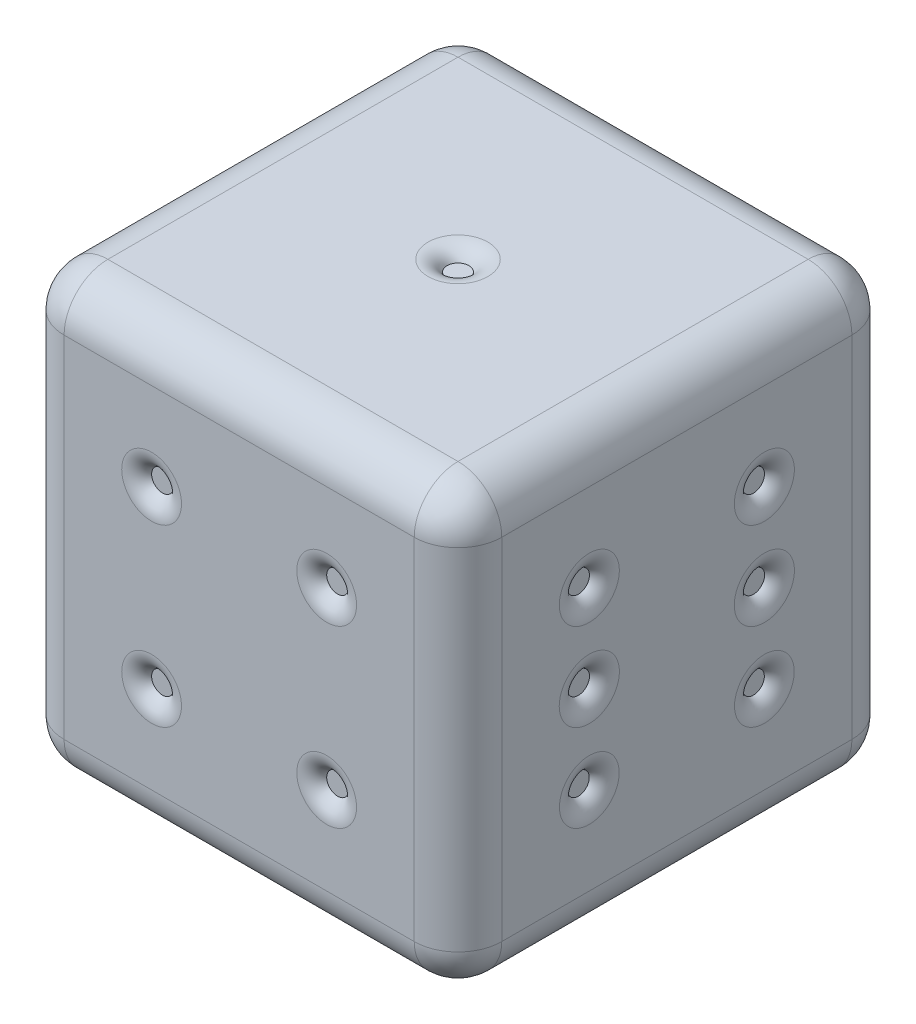
from build123d import *

# Parameters (mm, degrees)
SKETCH1_W           = 10
SKETCH1_H           = 10
BOSS_EXTRUDE1_DEPTH = 10
FILLET1_R           = 1
SKETCH3_R           = 0.25
CUT_EXTRUDE2_DEPTH  = 0.25
FILLET11_R          = 0.5
SKETCH4_R           = 0.25
CUT_EXTRUDE3_DEPTH  = 0.25
FILLET12_R          = 0.5
SKETCH6_R           = 0.25
CUT_EXTRUDE4_DEPTH  = 0.25
FILLET13_R          = 0.5
SKETCH10_R          = 0.249026036
SKETCH10_R_2        = 0.254407728
SKETCH10_R_3        = 0.252589149
CUT_EXTRUDE6_DEPTH  = 0.25
FILLET15_R          = 0.5
FILLET16_R          = 0.5
SKETCH12_R          = 0.25
CUT_EXTRUDE7_DEPTH  = 0.25
FILLET23_R          = 0.5
SKETCH13_R          = 0.25
CUT_EXTRUDE8_DEPTH  = 0.25
FILLET24_R          = 0.5


with BuildPart() as part:
    # Sketch1 → Boss-Extrude1 (new body)
    with BuildSketch(Plane(origin=(0, 0, 0), x_dir=(1, 0, 0), z_dir=(0, 1, 0))):
        Rectangle(SKETCH1_W, SKETCH1_H)
    extrude(amount=BOSS_EXTRUDE1_DEPTH)

    # Fillet1
    fillet1_edges = [part.edges().sort_by_distance(p)[0] for p in [
        (-5, 10, 0),
        (0, 10, 5),
        (5, 10, 0),
        (0, 0, 5),
        (-5, 0, 0),
        (0, 0, -5),
        (5, 0, 0),
        (5, 5, 5),
        (-5, 5, 5),
        (-5, 5, -5),
        (5, 5, -5),
        (0, 10, -5),
    ]]
    fillet(fillet1_edges, radius=FILLET1_R)

    # Sketch3 → Cut-Extrude2 (cut)
    with BuildSketch(Plane(origin=(0, 10, 0), x_dir=(1, 0, 0), z_dir=(0, 1, 0))):
        with Locations(Location((0, 0, 0), (0, 0, 270))):
            Circle(SKETCH3_R)
    extrude(amount=-CUT_EXTRUDE2_DEPTH, mode=Mode.SUBTRACT)

    # Fillet11
    # the kernel refuses this fillet: 0.5 mm, written as the material it takes off along each edge
    with BuildSketch(Plane(origin=(0, 10, 0), x_dir=(0, 0, 1), z_dir=(-1, 0, 0))) as fillet11_piece_1:
        with BuildLine():
            CenterArc((0.683012702, -0.5), FILLET11_R, 90, 60)
            Line((0.25, -0.25), (0.241339746, -0.245))
            ThreePointArc((0.241339746, -0.245), (0.24, -0.125), (0.24, 0))
            Line((0.24, 0), (0.25, 0.01))
            Line((0.25, 0.01), (0.683012702, 0.01))
            Line((0.683012702, 0.01), (0.683012702, 0))
        make_face()
    revolve(axis=Axis((0, 10, 0), (0, 1, 0)), mode=Mode.SUBTRACT)

    # Sketch4 → Cut-Extrude3 (cut)
    with BuildSketch(Plane.ZY.offset(5)):
        with Locations((2, 7)):
            Circle(SKETCH4_R)
        with Locations((-2, 3)):
            Circle(SKETCH4_R)
    extrude(amount=-CUT_EXTRUDE3_DEPTH, mode=Mode.SUBTRACT)

    # Fillet12
    # the kernel refuses this fillet: 0.5 mm, written as the material it takes off along each edge
    with BuildSketch(Plane(origin=(-5, 7, 2), x_dir=(0, 0, 1), z_dir=(0, -1, 0))) as fillet12_piece_1:
        with BuildLine():
            CenterArc((0.683012702, -0.5), FILLET12_R, 90, 60)
            Line((0.25, -0.25), (0.241339746, -0.245))
            ThreePointArc((0.241339746, -0.245), (0.24, -0.125), (0.24, 0))
            Line((0.24, 0), (0.25, 0.01))
            Line((0.25, 0.01), (0.683012702, 0.01))
            Line((0.683012702, 0.01), (0.683012702, 0))
        make_face()
    revolve(axis=Axis((-5, 7, 2), (-1, 0, 0)), mode=Mode.SUBTRACT)
    with BuildSketch(Plane(origin=(-5, 3, -2), x_dir=(0, 0, 1), z_dir=(0, -1, 0))) as fillet12_piece_2:
        with BuildLine():
            CenterArc((0.683012702, -0.5), FILLET12_R, 90, 60)
            Line((0.25, -0.25), (0.241339746, -0.245))
            ThreePointArc((0.241339746, -0.245), (0.24, -0.125), (0.24, 0))
            Line((0.24, 0), (0.25, 0.01))
            Line((0.25, 0.01), (0.683012702, 0.01))
            Line((0.683012702, 0.01), (0.683012702, 0))
        make_face()
    revolve(axis=Axis((-5, 3, -2), (-1, 0, 0)), mode=Mode.SUBTRACT)

    # Sketch6 → Cut-Extrude4 (cut)
    with BuildSketch(Plane(origin=(0, 0, 0), x_dir=(-1, 0, 0), z_dir=(0, -1, 0))):
        with Locations(Location((0, 0, 0), (0, 0, 90))):
            Circle(SKETCH6_R)
        with Locations(Location((2, -2, 0), (0, 0, 90))):
            Circle(SKETCH6_R)
        with Locations(Location((-2, 2, 0), (0, 0, 90))):
            Circle(SKETCH6_R)
    extrude(amount=-CUT_EXTRUDE4_DEPTH, mode=Mode.SUBTRACT)

    # Fillet13
    # the kernel refuses this fillet: 0.5 mm, written as the material it takes off along each edge
    with BuildSketch(Plane(origin=(2, 0, -2), x_dir=(0, 0, -1), z_dir=(-1, 0, 0))) as fillet13_piece_1:
        with BuildLine():
            CenterArc((0.683012702, -0.5), FILLET13_R, 90, 60)
            Line((0.25, -0.25), (0.241339746, -0.245))
            ThreePointArc((0.241339746, -0.245), (0.24, -0.125), (0.24, 0))
            Line((0.24, 0), (0.25, 0.01))
            Line((0.25, 0.01), (0.683012702, 0.01))
            Line((0.683012702, 0.01), (0.683012702, 0))
        make_face()
    revolve(axis=Axis((2, 0, -2), (0, -1, 0)), mode=Mode.SUBTRACT)
    with BuildSketch(Plane(origin=(-2, 0, 2), x_dir=(0, 0, -1), z_dir=(-1, 0, 0))) as fillet13_piece_2:
        with BuildLine():
            CenterArc((0.683012702, -0.5), FILLET13_R, 90, 60)
            Line((0.25, -0.25), (0.241339746, -0.245))
            ThreePointArc((0.241339746, -0.245), (0.24, -0.125), (0.24, 0))
            Line((0.24, 0), (0.25, 0.01))
            Line((0.25, 0.01), (0.683012702, 0.01))
            Line((0.683012702, 0.01), (0.683012702, 0))
        make_face()
    revolve(axis=Axis((-2, 0, 2), (0, -1, 0)), mode=Mode.SUBTRACT)
    with BuildSketch(Plane(origin=(0, 0, 0), x_dir=(0, 0, -1), z_dir=(-1, 0, 0))) as fillet13_piece_3:
        with BuildLine():
            CenterArc((0.683012702, -0.5), FILLET13_R, 90, 60)
            Line((0.25, -0.25), (0.241339746, -0.245))
            ThreePointArc((0.241339746, -0.245), (0.24, -0.125), (0.24, 0))
            Line((0.24, 0), (0.25, 0.01))
            Line((0.25, 0.01), (0.683012702, 0.01))
            Line((0.683012702, 0.01), (0.683012702, 0))
        make_face()
    revolve(axis=Axis((0, 0, 0), (0, -1, 0)), mode=Mode.SUBTRACT)

    # Sketch10 → Cut-Extrude6 (cut)
    with BuildSketch(Plane(origin=(5, 0, 0), x_dir=(0, 0, -1), z_dir=(1, 0, 0))):
        with Locations((2, 3)):
            Circle(SKETCH10_R)
        with Locations((2, 5)):
            Circle(SKETCH10_R_2)
        with Locations((2, 7)):
            Circle(SKETCH10_R_3)
        with Locations(Location((-2, 7, 0), (0, 0, 180))):
            Circle(SKETCH10_R_3)
        with Locations(Location((-2, 5, 0), (0, 0, 180))):
            Circle(SKETCH10_R_2)
        with Locations(Location((-2, 3, 0), (0, 0, 180))):
            Circle(SKETCH10_R)
    extrude(amount=-CUT_EXTRUDE6_DEPTH, mode=Mode.SUBTRACT)

    # Fillet15
    # the kernel refuses this fillet: 0.5 mm, written as the material it takes off along each edge
    with BuildSketch(Plane(origin=(5, 7, -2), x_dir=(0, 0, -1), z_dir=(0, -1, 0))) as fillet15_piece_1:
        with BuildLine():
            CenterArc((0.685601851, -0.5), FILLET15_R, 90, 60)
            Line((0.252589149, -0.25), (0.243928895, -0.245))
            ThreePointArc((0.243928895, -0.245), (0.242589149, -0.125), (0.242589149, 0))
            Line((0.242589149, 0), (0.252589149, 0.01))
            Line((0.252589149, 0.01), (0.685601851, 0.01))
            Line((0.685601851, 0.01), (0.685601851, 0))
        make_face()
    revolve(axis=Axis((5, 7, -2), (1, 0, 0)), mode=Mode.SUBTRACT)
    with BuildSketch(Plane(origin=(5, 5, -2), x_dir=(0, 0, -1), z_dir=(0, -1, 0))) as fillet15_piece_2:
        with BuildLine():
            CenterArc((0.68742043, -0.5), FILLET15_R, 90, 60)
            Line((0.254407728, -0.25), (0.245747474, -0.245))
            ThreePointArc((0.245747474, -0.245), (0.244407728, -0.125), (0.244407728, 0))
            Line((0.244407728, 0), (0.254407728, 0.01))
            Line((0.254407728, 0.01), (0.68742043, 0.01))
            Line((0.68742043, 0.01), (0.68742043, 0))
        make_face()
    revolve(axis=Axis((5, 5, -2), (1, 0, 0)), mode=Mode.SUBTRACT)
    with BuildSketch(Plane(origin=(5, 3, -2), x_dir=(0, 0, -1), z_dir=(0, -1, 0))) as fillet15_piece_3:
        with BuildLine():
            CenterArc((0.682038738, -0.5), FILLET15_R, 90, 60)
            Line((0.249026036, -0.25), (0.240365782, -0.245))
            ThreePointArc((0.240365782, -0.245), (0.239026036, -0.125), (0.239026036, 0))
            Line((0.239026036, 0), (0.249026036, 0.01))
            Line((0.249026036, 0.01), (0.682038738, 0.01))
            Line((0.682038738, 0.01), (0.682038738, 0))
        make_face()
    revolve(axis=Axis((5, 3, -2), (1, 0, 0)), mode=Mode.SUBTRACT)

    # Fillet16
    # the kernel refuses this fillet: 0.5 mm, written as the material it takes off along each edge
    with BuildSketch(Plane(origin=(5, 5, 2), x_dir=(0, 0, 1), z_dir=(0, 1, 0))) as fillet16_piece_1:
        with BuildLine():
            CenterArc((0.68742043, -0.5), FILLET16_R, 90, 60)
            Line((0.254407728, -0.25), (0.245747474, -0.245))
            ThreePointArc((0.245747474, -0.245), (0.244407728, -0.125), (0.244407728, 0))
            Line((0.244407728, 0), (0.254407728, 0.01))
            Line((0.254407728, 0.01), (0.68742043, 0.01))
            Line((0.68742043, 0.01), (0.68742043, 0))
        make_face()
    revolve(axis=Axis((5, 5, 2), (1, 0, 0)), mode=Mode.SUBTRACT)
    with BuildSketch(Plane(origin=(5, 7, 2), x_dir=(0, 0, 1), z_dir=(0, 1, 0))) as fillet16_piece_2:
        with BuildLine():
            CenterArc((0.685601851, -0.5), FILLET16_R, 90, 60)
            Line((0.252589149, -0.25), (0.243928895, -0.245))
            ThreePointArc((0.243928895, -0.245), (0.242589149, -0.125), (0.242589149, 0))
            Line((0.242589149, 0), (0.252589149, 0.01))
            Line((0.252589149, 0.01), (0.685601851, 0.01))
            Line((0.685601851, 0.01), (0.685601851, 0))
        make_face()
    revolve(axis=Axis((5, 7, 2), (1, 0, 0)), mode=Mode.SUBTRACT)
    with BuildSketch(Plane(origin=(5, 3, 2), x_dir=(0, 0, 1), z_dir=(0, 1, 0))) as fillet16_piece_3:
        with BuildLine():
            CenterArc((0.682038738, -0.5), FILLET16_R, 90, 60)
            Line((0.249026036, -0.25), (0.240365782, -0.245))
            ThreePointArc((0.240365782, -0.245), (0.239026036, -0.125), (0.239026036, 0))
            Line((0.239026036, 0), (0.249026036, 0.01))
            Line((0.249026036, 0.01), (0.682038738, 0.01))
            Line((0.682038738, 0.01), (0.682038738, 0))
        make_face()
    revolve(axis=Axis((5, 3, 2), (1, 0, 0)), mode=Mode.SUBTRACT)

    # Sketch12 → Cut-Extrude7 (cut)
    with BuildSketch(Plane.XY.offset(5)):
        with Locations((2, 3)):
            Circle(SKETCH12_R)
        with Locations((-2, 7)):
            Circle(SKETCH12_R)
        with Locations(Location((-2, 3, 0), (0, 0, 180))):
            Circle(SKETCH12_R)
        with Locations(Location((2, 7, 0), (0, 0, 180))):
            Circle(SKETCH12_R)
    cut_extrude7 = extrude(amount=-CUT_EXTRUDE7_DEPTH, mode=Mode.SUBTRACT)

    # Fillet23
    # the kernel refuses this fillet: 0.5 mm, written as the material it takes off along each edge
    with BuildSketch(Plane(origin=(2, 7, 5), x_dir=(-1, 0, 0), z_dir=(0, 1, 0))) as fillet23_piece_1:
        with BuildLine():
            CenterArc((0.683012702, -0.5), FILLET23_R, 90, 60)
            Line((0.25, -0.25), (0.241339746, -0.245))
            ThreePointArc((0.241339746, -0.245), (0.24, -0.125), (0.24, 0))
            Line((0.24, 0), (0.25, 0.01))
            Line((0.25, 0.01), (0.683012702, 0.01))
            Line((0.683012702, 0.01), (0.683012702, 0))
        make_face()
    revolve(axis=Axis((2, 7, 5), (0, 0, 1)), mode=Mode.SUBTRACT)
    with BuildSketch(Plane(origin=(-2, 3, 5), x_dir=(-1, 0, 0), z_dir=(0, 1, 0))) as fillet23_piece_2:
        with BuildLine():
            CenterArc((0.683012702, -0.5), FILLET23_R, 90, 60)
            Line((0.25, -0.25), (0.241339746, -0.245))
            ThreePointArc((0.241339746, -0.245), (0.24, -0.125), (0.24, 0))
            Line((0.24, 0), (0.25, 0.01))
            Line((0.25, 0.01), (0.683012702, 0.01))
            Line((0.683012702, 0.01), (0.683012702, 0))
        make_face()
    revolve(axis=Axis((-2, 3, 5), (0, 0, 1)), mode=Mode.SUBTRACT)
    with BuildSketch(Plane(origin=(2, 3, 5), x_dir=(1, 0, 0), z_dir=(0, -1, 0))) as fillet23_piece_3:
        with BuildLine():
            CenterArc((0.683012702, -0.5), FILLET23_R, 90, 60)
            Line((0.25, -0.25), (0.241339746, -0.245))
            ThreePointArc((0.241339746, -0.245), (0.24, -0.125), (0.24, 0))
            Line((0.24, 0), (0.25, 0.01))
            Line((0.25, 0.01), (0.683012702, 0.01))
            Line((0.683012702, 0.01), (0.683012702, 0))
        make_face()
    revolve(axis=Axis((2, 3, 5), (0, 0, 1)), mode=Mode.SUBTRACT)
    with BuildSketch(Plane(origin=(-2, 7, 5), x_dir=(1, 0, 0), z_dir=(0, -1, 0))) as fillet23_piece_4:
        with BuildLine():
            CenterArc((0.683012702, -0.5), FILLET23_R, 90, 60)
            Line((0.25, -0.25), (0.241339746, -0.245))
            ThreePointArc((0.241339746, -0.245), (0.24, -0.125), (0.24, 0))
            Line((0.24, 0), (0.25, 0.01))
            Line((0.25, 0.01), (0.683012702, 0.01))
            Line((0.683012702, 0.01), (0.683012702, 0))
        make_face()
    revolve(axis=Axis((-2, 7, 5), (0, 0, 1)), mode=Mode.SUBTRACT)

    # Mirror3: Cut-Extrude7 across plane
    add(cut_extrude7.mirror(Plane.XY), mode=Mode.SUBTRACT)

    # Sketch13 → Cut-Extrude8 (cut)
    with BuildSketch(Plane(origin=(0, 0, -5), x_dir=(-1, 0, 0), z_dir=(0, 0, -1))):
        with Locations((0, 5)):
            Circle(SKETCH13_R)
    extrude(amount=-CUT_EXTRUDE8_DEPTH, mode=Mode.SUBTRACT)

    # Fillet24
    # the kernel refuses this fillet: 0.5 mm, written as the material it takes off along each edge
    with BuildSketch(Plane(origin=(2, 7, -5), x_dir=(-1, 0, 0), z_dir=(0, 1, 0))) as fillet24_piece_1:
        with BuildLine():
            CenterArc((0.683012702, 0.5), FILLET24_R, 210, 60)
            Line((0.25, 0.25), (0.241339746, 0.245))
            ThreePointArc((0.241339746, 0.245), (0.24, 0.125), (0.24, 0))
            Line((0.24, 0), (0.25, -0.01))
            Line((0.25, -0.01), (0.683012702, -0.01))
            Line((0.683012702, -0.01), (0.683012702, 0))
        make_face()
    revolve(axis=Axis((2, 7, -5), (0, 0, 1)), mode=Mode.SUBTRACT)
    with BuildSketch(Plane(origin=(-2, 3, -5), x_dir=(-1, 0, 0), z_dir=(0, 1, 0))) as fillet24_piece_2:
        with BuildLine():
            CenterArc((0.683012702, 0.5), FILLET24_R, 210, 60)
            Line((0.25, 0.25), (0.241339746, 0.245))
            ThreePointArc((0.241339746, 0.245), (0.24, 0.125), (0.24, 0))
            Line((0.24, 0), (0.25, -0.01))
            Line((0.25, -0.01), (0.683012702, -0.01))
            Line((0.683012702, -0.01), (0.683012702, 0))
        make_face()
    revolve(axis=Axis((-2, 3, -5), (0, 0, 1)), mode=Mode.SUBTRACT)
    with BuildSketch(Plane(origin=(2, 3, -5), x_dir=(1, 0, 0), z_dir=(0, -1, 0))) as fillet24_piece_3:
        with BuildLine():
            CenterArc((0.683012702, 0.5), FILLET24_R, 210, 60)
            Line((0.25, 0.25), (0.241339746, 0.245))
            ThreePointArc((0.241339746, 0.245), (0.24, 0.125), (0.24, 0))
            Line((0.24, 0), (0.25, -0.01))
            Line((0.25, -0.01), (0.683012702, -0.01))
            Line((0.683012702, -0.01), (0.683012702, 0))
        make_face()
    revolve(axis=Axis((2, 3, -5), (0, 0, 1)), mode=Mode.SUBTRACT)
    with BuildSketch(Plane(origin=(-2, 7, -5), x_dir=(1, 0, 0), z_dir=(0, -1, 0))) as fillet24_piece_4:
        with BuildLine():
            CenterArc((0.683012702, 0.5), FILLET24_R, 210, 60)
            Line((0.25, 0.25), (0.241339746, 0.245))
            ThreePointArc((0.241339746, 0.245), (0.24, 0.125), (0.24, 0))
            Line((0.24, 0), (0.25, -0.01))
            Line((0.25, -0.01), (0.683012702, -0.01))
            Line((0.683012702, -0.01), (0.683012702, 0))
        make_face()
    revolve(axis=Axis((-2, 7, -5), (0, 0, 1)), mode=Mode.SUBTRACT)
    with BuildSketch(Plane(origin=(0, 5, -5), x_dir=(-1, 0, 0), z_dir=(0, -1, 0))) as fillet24_piece_5:
        with BuildLine():
            CenterArc((0.683012702, -0.5), FILLET24_R, 90, 60)
            Line((0.25, -0.25), (0.241339746, -0.245))
            ThreePointArc((0.241339746, -0.245), (0.24, -0.125), (0.24, 0))
            Line((0.24, 0), (0.25, 0.01))
            Line((0.25, 0.01), (0.683012702, 0.01))
            Line((0.683012702, 0.01), (0.683012702, 0))
        make_face()
    revolve(axis=Axis((0, 5, -5), (0, 0, -1)), mode=Mode.SUBTRACT)


solid = part.part
